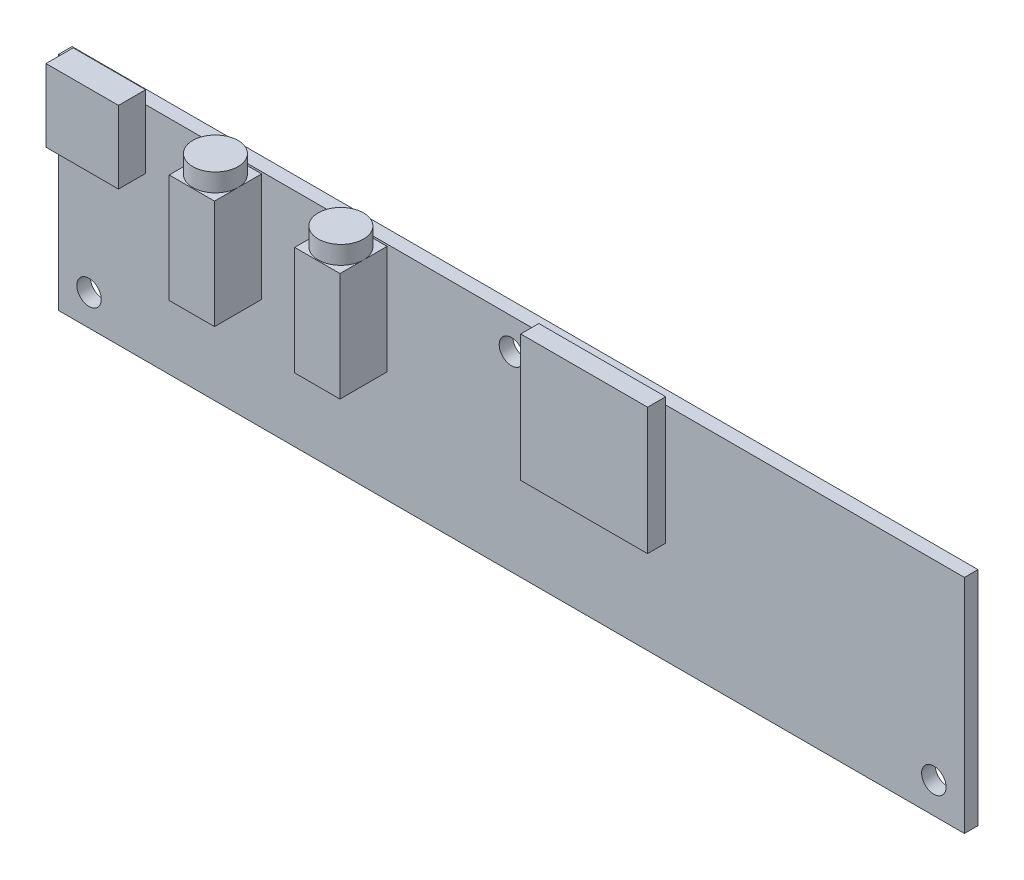
from build123d import *

# Parameters (mm, degrees)
SKETCH_1_W      = 100
SKETCH_1_H      = 24.48
SKETCH_1_R      = 1.35
EXTRUDE_1_DEPTH = 1.5
SKETCH_2_W      = 5
SKETCH_2_H      = 12
EXTRUDE_2_DEPTH = 5.2
SKETCH_2_3_W    = 8
SKETCH_2_3_H    = 8
EXTRUDE_3_DEPTH = 3
SKETCH_3_R      = 2.5
EXTRUDE_4_DEPTH = 2
SKETCH_2_4_W    = 8
SKETCH_2_4_H    = 8
SKETCH_2_4_W_2  = 5
SKETCH_2_4_H_2  = 12
SKETCH_2_4_W_3  = 14
SKETCH_2_4_H_3  = 14
EXTRUDE_5_DEPTH = 2


with BuildPart() as part:
    # Эскиз1 → Бобышка-Вытянуть1 (new body)
    with BuildSketch(Plane.XY):
        Rectangle(SKETCH_1_W, SKETCH_1_H)
        with Locations((-46.625, -8.825)):
            Circle(SKETCH_1_R, mode=Mode.SUBTRACT)
        with Locations((46.625, -8.825)):
            Circle(SKETCH_1_R, mode=Mode.SUBTRACT)
        with Locations((0, 8.825)):
            Circle(SKETCH_1_R, mode=Mode.SUBTRACT)
    extrude(amount=EXTRUDE_1_DEPTH)

    # Эскиз2 → Бобышка-Вытянуть2 (add)
    with BuildSketch(Plane.XY.offset(1.5)):
        with Locations((-30.075, 6.025)):
            Rectangle(SKETCH_2_W, SKETCH_2_H)
        with Locations((-16.225, 6.025)):
            Rectangle(SKETCH_2_W, SKETCH_2_H)
    extrude(amount=EXTRUDE_2_DEPTH)

    # Эскиз2<3> → Бобышка-Вытянуть3 (add)
    with BuildSketch(Plane.XY.offset(1.5)):
        with Locations((-44.375, 9.675)):
            Rectangle(SKETCH_2_3_W, SKETCH_2_3_H)
    extrude(amount=EXTRUDE_3_DEPTH)

    # Эскиз3 → Бобышка-Вытянуть4 (add)
    with BuildSketch(Plane(origin=(0, 12.025, 0), x_dir=(1, 0, 0), z_dir=(0, 1, 0))):
        with Locations((-16.225, -4.1)):
            Circle(SKETCH_3_R)
        with Locations((-30.075, -4.1)):
            Circle(SKETCH_3_R)
    extrude(amount=EXTRUDE_4_DEPTH)

    # Эскиз2<4> → Бобышка-Вытянуть5 (add)
    with BuildSketch(Plane.XY.offset(1.5)):
        with Locations((-44.375, 9.675)):
            Rectangle(SKETCH_2_4_W, SKETCH_2_4_H)
        with Locations((-30.075, 6.025)):
            Rectangle(SKETCH_2_4_W_2, SKETCH_2_4_H_2)
        with Locations((-16.225, 6.025)):
            Rectangle(SKETCH_2_4_W_2, SKETCH_2_4_H_2)
        with Locations((10.025, 6.025)):
            Rectangle(SKETCH_2_4_W_3, SKETCH_2_4_H_3)
    extrude(amount=EXTRUDE_5_DEPTH)


solid = part.part
